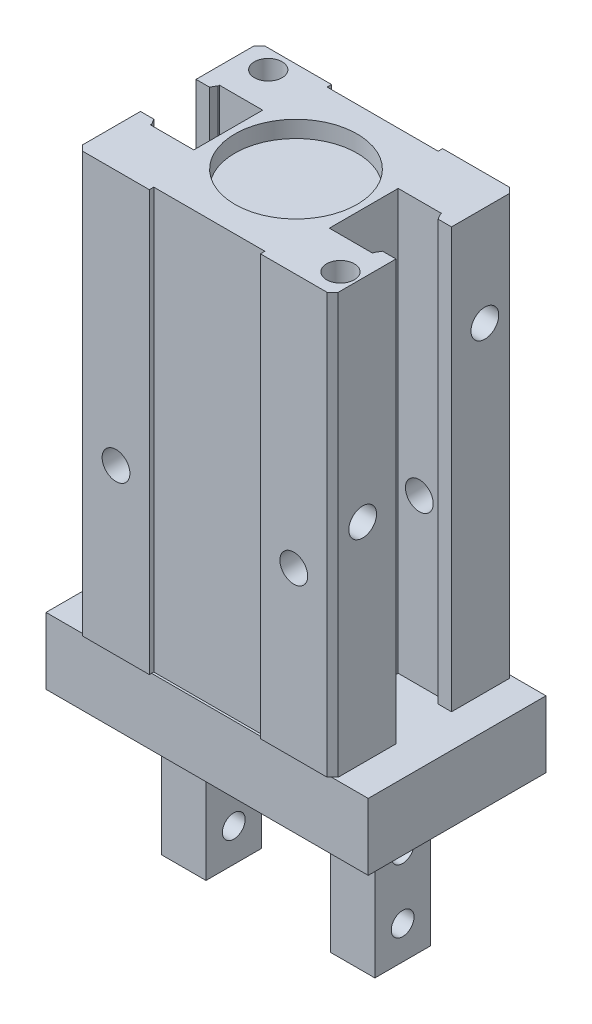
from build123d import *
from OCP.BRepFilletAPI import BRepFilletAPI_MakeChamfer

# Parameters (mm, degrees)
SKETCH_1_W             = 23
SKETCH_1_H             = 37.8
EXTRUDE_1_DEPTH        = 16.4
SKETCH_19_W            = 29
SKETCH_19_H            = 16
EXTRUDE_3_DEPTH        = 6
SKETCH_5_W             = 4
SKETCH_5_H             = 5
EXTRUDE_2_DEPTH        = 13.2
SKETCH_20_W            = 2.9
SKETCH_20_H            = 1.2
SKETCH_20_W_2          = 5.1
EXTRUDE_4_DEPTH        = 5
HOLE_WIZARD_M2_5_1_D   = 2.05
HOLE_WIZARD_M3_6_D     = 2.5
HOLE_WIZARD_M3_6_DEPTH = 7.5
HOLE_WIZARD_M3_6_TIP   = 0.751075774
HOLE_WIZARD_M3_7_D     = 2.5
HOLE_WIZARD_M3_7_DEPTH = 7.5
HOLE_WIZARD_M3_7_TIP   = 0.751075774
HOLE_WIZARD_M3_5_D     = 2.5
SKETCH_15_R            = 5.5
CUT_EXTRUDE_4_DEPTH    = 1.5
HOLE_WIZARD_M3_4_D     = 2.5
HOLE_WIZARD_M3_4_DEPTH = 7.5
HOLE_WIZARD_M3_4_TIP   = 0.751075774
CUT_EXTRUDE_5_REACH    = 66.761
CHAMFER_1_SIZE         = 0.5
CHAMFER_1_SIZE2        = 0.288675135
CHAMFER_2_SIZE         = 0.5
CHAMFER_2_SIZE2        = 0.288675135
SKETCH_25_W            = 10
SKETCH_25_H            = 0.4
CUT_EXTRUDE_6_DEPTH    = 37.8
CHAMFER_3_SIZE         = 0.5


with BuildPart() as part:
    # 草图1 → 拉伸1 (new body)
    with BuildSketch(Plane.XY):
        with Locations((11.5, 18.9)):
            Rectangle(SKETCH_1_W, SKETCH_1_H)
    extrude(amount=EXTRUDE_1_DEPTH)

    # 草图19 → 拉伸3 (add)
    with BuildSketch(Plane.XZ):
        with Locations((11.5, 8.2)):
            Rectangle(SKETCH_19_W, SKETCH_19_H)
    extrude(amount=EXTRUDE_3_DEPTH)

    # 草图5 → 拉伸2 (add)
    with BuildSketch(Plane.XZ.offset(6)):
        with Locations((3.9, 8.2)):
            Rectangle(SKETCH_5_W, SKETCH_5_H)
        with Locations((19.1, 8.2)):
            Rectangle(SKETCH_5_W, SKETCH_5_H)
    extrude(amount=EXTRUDE_2_DEPTH)

    # 草图20 → 拉伸4 (add)
    with BuildSketch(Plane.XY.offset(10.7)):
        with Locations((0.45, -6.6)):
            Rectangle(SKETCH_20_W, SKETCH_20_H)
        with Locations((8.45, -6.6)):
            Rectangle(SKETCH_20_W_2, SKETCH_20_H)
        with Locations((14.55, -6.6)):
            Rectangle(SKETCH_20_W_2, SKETCH_20_H)
        with Locations((22.55, -6.6)):
            Rectangle(SKETCH_20_W, SKETCH_20_H)
    extrude(amount=-EXTRUDE_4_DEPTH)

    # M2.5 螺纹孔1 (through all)
    with Locations(Plane(origin=(21.1, 0, 0), x_dir=(0, 0, -1), z_dir=(1, 0, 0))):
        with Locations((-8.2, -16.2), (-8.2, -10.5)):
            Hole(HOLE_WIZARD_M2_5_1_D / 2)

    # M3 螺纹孔6
    with Locations(Plane(origin=(23, 0, 0), x_dir=(0, 0, -1), z_dir=(1, 0, 0))):
        with Locations((-2.7, 28.8), (-13.7, 18.8)):
            Hole(HOLE_WIZARD_M3_6_D / 2, depth=HOLE_WIZARD_M3_6_DEPTH)
            with Locations((0, 0, -(HOLE_WIZARD_M3_6_DEPTH + HOLE_WIZARD_M3_6_TIP / 2))):  # 118° drill point
                Cone(0, HOLE_WIZARD_M3_6_D / 2, HOLE_WIZARD_M3_6_TIP, mode=Mode.SUBTRACT)

    # M3 螺纹孔7
    with Locations(Plane.ZY):
        with Locations((2.5, 10.8), (13.9, 10.8)):
            Hole(HOLE_WIZARD_M3_7_D / 2, depth=HOLE_WIZARD_M3_7_DEPTH)
            with Locations((0, 0, -(HOLE_WIZARD_M3_7_DEPTH + HOLE_WIZARD_M3_7_TIP / 2))):  # 118° drill point
                Cone(0, HOLE_WIZARD_M3_7_D / 2, HOLE_WIZARD_M3_7_TIP, mode=Mode.SUBTRACT)

    # M3 螺纹孔5 (through all)
    with Locations(Plane.XY.offset(16.4)):
        with Locations((3.5, 14.8), (19.5, 14.8)):
            Hole(HOLE_WIZARD_M3_5_D / 2)

    # 草图15 → 切除-拉伸4 (cut)
    with BuildSketch(Plane(origin=(0, 37.8, 0), x_dir=(1, 0, 0), z_dir=(0, 1, 0))):
        with Locations(Location((11.5, -8.2, 0), (0, 0, 270))):
            Circle(SKETCH_15_R)
    extrude(amount=-CUT_EXTRUDE_4_DEPTH, mode=Mode.SUBTRACT)

    # M3 螺纹孔4
    with Locations(Plane(origin=(0, 37.8, 0), x_dir=(-1, 0, 0), z_dir=(0, 1, 0))):
        with Locations((-2.5, 1.7), (-21.5, 14.2)):
            Hole(HOLE_WIZARD_M3_4_D / 2, depth=HOLE_WIZARD_M3_4_DEPTH)
            with Locations((0, 0, -(HOLE_WIZARD_M3_4_DEPTH + HOLE_WIZARD_M3_4_TIP / 2))):  # 118° drill point
                Cone(0, HOLE_WIZARD_M3_4_D / 2, HOLE_WIZARD_M3_4_TIP, mode=Mode.SUBTRACT)

    # 切除-拉伸5: up to this face of the body (flat: up to its plane)
    cut_extrude_5_end = Plane(part.part.faces().sort_by_distance((-1.5, 0, 8.2))[0])
    # 草图18 → 切除-拉伸5 (cut, up to the picked face)
    with BuildSketch(Plane(origin=(0, 37.8, 0), x_dir=(1, 0, 0), z_dir=(0, 1, 0)), mode=Mode.PRIVATE) as cut_extrude_5_sk1:
        Polygon((23, -10.7), (23, -5.7), (21.5, -5.7), (21.5, -5.1), (17.6, -5.1), (17.6, -11.3), (21.5, -11.3), (21.5, -10.7), align=None)
    cut_extrude_5_tool1 = split(extrude(cut_extrude_5_sk1.sketch, amount=-CUT_EXTRUDE_5_REACH, mode=Mode.PRIVATE), bisect_by=cut_extrude_5_end, keep=Keep.BOTH, mode=Mode.PRIVATE)
    # 草图18 → 切除-拉伸5 (cut, up to the picked face)
    with BuildSketch(Plane(origin=(0, 37.8, 0), x_dir=(1, 0, 0), z_dir=(0, 1, 0)), mode=Mode.PRIVATE) as cut_extrude_5_sk2:
        Polygon((0, -10.7), (1.5, -10.7), (1.5, -11.3), (5.4, -11.3), (5.4, -5.1), (1.5, -5.1), (1.5, -5.7), (0, -5.7), align=None)
    cut_extrude_5_tool2 = split(extrude(cut_extrude_5_sk2.sketch, amount=-CUT_EXTRUDE_5_REACH, mode=Mode.PRIVATE), bisect_by=cut_extrude_5_end, keep=Keep.BOTH, mode=Mode.PRIVATE)
    add(cut_extrude_5_tool1.solids().sort_by(Axis((20.189205, 37.8, 8.2), (0, -1, 0)))[0], mode=Mode.SUBTRACT)
    add(cut_extrude_5_tool2.solids().sort_by(Axis((2.810795, 37.8, 8.2), (0, -1, 0)))[0], mode=Mode.SUBTRACT)

    # 倒角1: one chamfer whose edges measure the first distance from different faces: ONE call of the kernel's chamfer builder (chamfer() names one face for all edges)
    chamfer_1_edges_1 = [part.edges().sort_by_distance(p)[0] for p in [
        (21.5, 18.9, 10.7),
    ]]
    chamfer_1_side_1 = [part.faces().sort_by_distance(p)[0] for p in [
        (21.5, 18.9, 11),
    ]]
    chamfer_1_edges_2 = [part.edges().sort_by_distance(p)[0] for p in [
        (1.5, 18.9, 5.7),
    ]]
    chamfer_1_side_2 = [part.faces().sort_by_distance(p)[0] for p in [
        (1.5, 18.9, 5.4),
    ]]
    chamfer_1 = BRepFilletAPI_MakeChamfer(part.part.solid().wrapped)
    for e in chamfer_1_edges_1:
        chamfer_1.Add(CHAMFER_1_SIZE, CHAMFER_1_SIZE2, e.wrapped, chamfer_1_side_1[0].wrapped)  # the first distance lies on this face
    for e in chamfer_1_edges_2:
        chamfer_1.Add(CHAMFER_1_SIZE, CHAMFER_1_SIZE2, e.wrapped, chamfer_1_side_2[0].wrapped)  # the first distance lies on this face
    add(Compound.cast(chamfer_1.Shape()), mode=Mode.REPLACE)

    # 倒角2: one chamfer whose edges measure the first distance from different faces: ONE call of the kernel's chamfer builder (chamfer() names one face for all edges)
    chamfer_2_edges_1 = [part.edges().sort_by_distance(p)[0] for p in [
        (21.5, 18.9, 5.7),
    ]]
    chamfer_2_side_1 = [part.faces().sort_by_distance(p)[0] for p in [
        (21.5, 18.9, 5.4),
    ]]
    chamfer_2_edges_2 = [part.edges().sort_by_distance(p)[0] for p in [
        (1.5, 18.9, 10.7),
    ]]
    chamfer_2_side_2 = [part.faces().sort_by_distance(p)[0] for p in [
        (1.5, 18.9, 11),
    ]]
    chamfer_2 = BRepFilletAPI_MakeChamfer(part.part.solid().wrapped)
    for e in chamfer_2_edges_1:
        chamfer_2.Add(CHAMFER_2_SIZE, CHAMFER_2_SIZE2, e.wrapped, chamfer_2_side_1[0].wrapped)  # the first distance lies on this face
    for e in chamfer_2_edges_2:
        chamfer_2.Add(CHAMFER_2_SIZE, CHAMFER_2_SIZE2, e.wrapped, chamfer_2_side_2[0].wrapped)  # the first distance lies on this face
    add(Compound.cast(chamfer_2.Shape()), mode=Mode.REPLACE)

    # 草图25 → 切除-拉伸6 (cut)
    with BuildSketch(Plane(origin=(0, 37.8, 0), x_dir=(1, 0, 0), z_dir=(0, 1, 0))):
        with Locations((11.5, -0.2)):
            Rectangle(SKETCH_25_W, SKETCH_25_H)
        with Locations((11.5, -16.2)):
            Rectangle(SKETCH_25_W, SKETCH_25_H)
    extrude(amount=-CUT_EXTRUDE_6_DEPTH, mode=Mode.SUBTRACT)

    # 倒角3
    # the kernel refuses this chamfer: 0.5 mm, written as the material it takes off along each edge
    with BuildSketch(Plane(origin=(23, 0, 16.4), x_dir=(-0.9996219169112968, 0, 0.027495876610589005), z_dir=(0, 1, 0)), Plane(origin=(23, 0, 0), x_dir=(0.02749587661058908, 0, 0.9996219169112968), z_dir=(0, 1, 0))) as chamfer_3_piece_1:
        Polygon((CHAMFER_3_SIZE * 0.999621916911, -CHAMFER_3_SIZE * 0.0274958766106), (-CHAMFER_3_SIZE * 0.0274958766106, -CHAMFER_3_SIZE * 0.999621916911), (0, 0), align=None)
    extrude(amount=39.085841494, mode=Mode.SUBTRACT)
    with BuildSketch(Plane(origin=(0, 39.085841494, 16.4), x_dir=(-0.02749587661058639, 0, -0.9996219169112968), z_dir=(0, -1, 0)), Plane(origin=(0, 39.085841494, 0), x_dir=(0.9996219169112968, 0, -0.027495876610586372), z_dir=(0, -1, 0))) as chamfer_3_piece_2:
        Polygon((CHAMFER_3_SIZE * 0.999621916911, CHAMFER_3_SIZE * 0.0274958766106), (-CHAMFER_3_SIZE * 0.0274958766106, CHAMFER_3_SIZE * 0.999621916911), (0, 0), align=None)
    extrude(amount=39.085841494, mode=Mode.SUBTRACT)


solid = part.part
